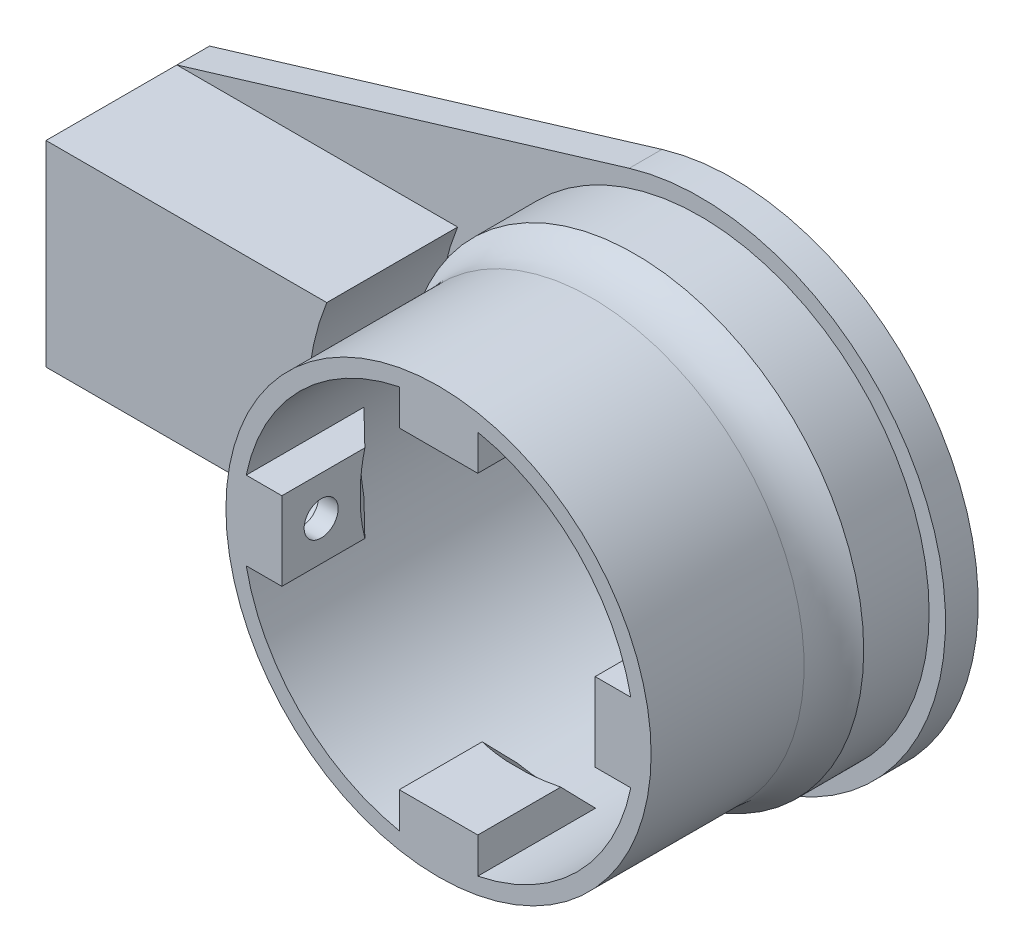
from build123d import *

# Parameters (mm, degrees)
ESQUISSE1_R                  = 30
BOSS_EXTRU_1_DEPTH           = 5
ESQUISSE6_R                  = 35
ESQUISSE6_R_2                = 30
BOSS_EXTRU_6_DEPTH           = 10
ESQUISSE7_R                  = 32.5
ESQUISSE7_R_2                = 30
BOSS_EXTRU_8_DEPTH           = 30
CONG_2_R                     = 10
BOSS_EXTRU_9_DEPTH           = 20
ESQUISSE9_W                  = 8
ESQUISSE9_H                  = 12
ESQUISSE9_W_2                = 12
ESQUISSE9_H_2                = 8
BOSS_EXTRU_10_DEPTH          = 12
CHANFREIN1_SIZE              = 6
ENL_V_MAT_EXTRU_1_REACH      = 86.89
ENL_V_MAT_EXTRU_1_END_RADIUS = 32.5
ESQUISSE10_R                 = 4.5
ESQUISSE12_R                 = 4.5
ESQUISSE12_R_2               = 2.6
BOSS_EXTRU_11_DEPTH          = 3


with BuildPart() as part:
    # Esquisse1 → Boss.-Extru.1 (new body)
    with BuildSketch(Plane.XY):
        with BuildLine():
            Line((-10.847469364, 35.896830061), (-80, 15))
            Line((-80, 15), (-80, -15))
            Line((-80, -15), (-10.847469364, -35.896830061))
            ThreePointArc((-10.847469364, -35.896830061), (37.5, 0), (-10.847469364, 35.896830061))
        make_face()
        Circle(ESQUISSE1_R, mode=Mode.SUBTRACT)
    extrude(amount=BOSS_EXTRU_1_DEPTH)

    # Esquisse6 → Boss.-Extru.6 (add)
    with BuildSketch(Plane.XY.offset(5)):
        Circle(ESQUISSE6_R)
        Circle(ESQUISSE6_R_2, mode=Mode.SUBTRACT)
    extrude(amount=BOSS_EXTRU_6_DEPTH)

    # Esquisse7 → Boss.-Extru.8 (add)
    with BuildSketch(Plane.XY.offset(15)):
        Circle(ESQUISSE7_R)
        Circle(ESQUISSE7_R_2, mode=Mode.SUBTRACT)
    extrude(amount=BOSS_EXTRU_8_DEPTH)

    # Congé2
    # the kernel refuses this fillet: 10 mm, written as the material it adds along each edge
    with BuildSketch(Plane(origin=(0, 0, 15), x_dir=(1, 0, 0), z_dir=(0, -1, 0))) as cong_2_piece_1:
        with BuildLine():
            CenterArc((42.5, 6.614378278), CONG_2_R, 180, 41.409622109)
            Line((32.5, 6.614378278), (32.3, 6.614378278))
            Line((32.3, 6.614378278), (32.3, 0))
            Line((32.3, 0), (32.5, -0.2))
            ThreePointArc((32.5, -0.2), (33.75, -0.2), (34.85, -0.132287566))
            Line((34.85, -0.132287566), (35, 0))
        make_face()
    revolve(axis=Axis((0, 0, 15), (0, 0, 1)))

    # Esquisse8 → Boss.-Extru.9 (add)
    with BuildSketch(Plane.XY.offset(5)):
        with BuildLine():
            Line((-80, 15), (-37.080992435, 15))
            ThreePointArc((-37.080992435, 15), (-40, 0), (-37.080992435, -15))
            Line((-37.080992435, -15), (-80, -15))
            Line((-80, -15), (-80, 15))
        make_face()
    extrude(amount=BOSS_EXTRU_9_DEPTH)

    # Esquisse9 → Boss.-Extru.10 (add)
    with BuildSketch(Plane.XY.offset(45)):
        with Locations((-27.941352507, 0)):
            Rectangle(ESQUISSE9_W, ESQUISSE9_H)
        with Locations((0, 27.941352507)):
            Rectangle(ESQUISSE9_W_2, ESQUISSE9_H_2)
        with Locations((27.941352507, 0)):
            Rectangle(ESQUISSE9_W, ESQUISSE9_H)
        with Locations((0, -27.941352507)):
            Rectangle(ESQUISSE9_W_2, ESQUISSE9_H_2)
    extrude(amount=-BOSS_EXTRU_10_DEPTH)

    # Chanfrein1
    # the kernel refuses this chamfer: 6 mm, written as the material it adds along each edge
    with BuildSketch(Plane(origin=(0, 0, 33), x_dir=(-0.6561519302770997, 0.75462881232672, 0), z_dir=(-0.75462881232672, -0.6561519302770997, 0))) as chanfrein1_piece_1_section:
        Polygon((30, CHANFREIN1_SIZE), (30 - CHANFREIN1_SIZE, 0), (30, 0), align=None)
    chanfrein1_piece_1 = revolve(axis=Axis((0, 0, 33), (0, 0, -1)), revolution_arc=82.01410645, mode=Mode.PRIVATE)
    chanfrein1_piece_1 = split(chanfrein1_piece_1, bisect_by=Plane(origin=(-6, 27.82841678, 31.008979001), z_dir=(1, 0, 0)), keep=Keep.TOP, mode=Mode.PRIVATE)
    chanfrein1_piece_1 = split(chanfrein1_piece_1, bisect_by=Plane(origin=(6, 27.82841678, 31.008979001), z_dir=(-1, 0, 0)), keep=Keep.TOP, mode=Mode.PRIVATE)
    chanfrein1_piece_1 = split(chanfrein1_piece_1, bisect_by=Plane(origin=(0, 23.941352507, 31.008979001), z_dir=(0, 1, 0)), keep=Keep.TOP, mode=Mode.PRIVATE)
    add(chanfrein1_piece_1)
    with BuildSketch(Plane(origin=(0, 0, 33), x_dir=(0.754635493716526, 0.6561442460490032, 0), z_dir=(-0.6561442460490032, 0.754635493716526, 0))) as chanfrein1_piece_2_section:
        Polygon((30, CHANFREIN1_SIZE), (30 - CHANFREIN1_SIZE, 0), (30, 0), align=None)
    chanfrein1_piece_2 = revolve(axis=Axis((0, 0, 33), (0, 0, -1)), revolution_arc=41.006469797, mode=Mode.PRIVATE)
    chanfrein1_piece_2 = split(chanfrein1_piece_2, bisect_by=Plane(origin=(27.828416771, 6, 31.008979004), z_dir=(0, -1, 0)), keep=Keep.TOP, mode=Mode.PRIVATE)
    chanfrein1_piece_2 = split(chanfrein1_piece_2, bisect_by=Plane(origin=(23.941352507, 3.002348554, 31.008979004), z_dir=(1, 0, 0)), keep=Keep.TOP, mode=Mode.PRIVATE)
    add(chanfrein1_piece_2)
    with BuildSketch(Plane(origin=(0, 0, 33), x_dir=(0.6561519302770998, -0.7546288123267199, 0), z_dir=(0.7546288123267199, 0.6561519302770998, 0))) as chanfrein1_piece_3_section:
        Polygon((30, CHANFREIN1_SIZE), (30 - CHANFREIN1_SIZE, 0), (30, 0), align=None)
    chanfrein1_piece_3 = revolve(axis=Axis((0, 0, 33), (0, 0, -1)), revolution_arc=82.01410645, mode=Mode.PRIVATE)
    chanfrein1_piece_3 = split(chanfrein1_piece_3, bisect_by=Plane(origin=(6, -27.82841678, 31.008979001), z_dir=(-1, 0, 0)), keep=Keep.TOP, mode=Mode.PRIVATE)
    chanfrein1_piece_3 = split(chanfrein1_piece_3, bisect_by=Plane(origin=(-6, -27.82841678, 31.008979001), z_dir=(1, 0, 0)), keep=Keep.TOP, mode=Mode.PRIVATE)
    chanfrein1_piece_3 = split(chanfrein1_piece_3, bisect_by=Plane(origin=(0, -23.941352507, 31.008979001), z_dir=(0, -1, 0)), keep=Keep.TOP, mode=Mode.PRIVATE)
    add(chanfrein1_piece_3)
    with BuildSketch(Plane(origin=(0, 0, 33), x_dir=(-0.7546288123267202, -0.6561519302770997, 0), z_dir=(0.6561519302770997, -0.7546288123267202, 0))) as chanfrein1_piece_4_section:
        Polygon((30, CHANFREIN1_SIZE), (30 - CHANFREIN1_SIZE, 0), (30, 0), align=None)
    chanfrein1_piece_4 = revolve(axis=Axis((0, 0, 33), (0, 0, -1)), revolution_arc=82.01410645, mode=Mode.PRIVATE)
    chanfrein1_piece_4 = split(chanfrein1_piece_4, bisect_by=Plane(origin=(-27.82841678, -6, 31.008979), z_dir=(0, 1, 0)), keep=Keep.TOP, mode=Mode.PRIVATE)
    chanfrein1_piece_4 = split(chanfrein1_piece_4, bisect_by=Plane(origin=(-27.82841678, 6, 31.008979), z_dir=(0, -1, 0)), keep=Keep.TOP, mode=Mode.PRIVATE)
    chanfrein1_piece_4 = split(chanfrein1_piece_4, bisect_by=Plane(origin=(-23.941352507, 0, 31.008979), z_dir=(-1, 0, 0)), keep=Keep.TOP, mode=Mode.PRIVATE)
    add(chanfrein1_piece_4)
    with BuildSketch(Plane(origin=(0, 0, 33), x_dir=(1, 0, 0), z_dir=(0, 1, 0))) as chanfrein1_piece_5_section:
        Polygon((30, CHANFREIN1_SIZE), (30 - CHANFREIN1_SIZE, 0), (30, 0), align=None)
    chanfrein1_piece_5 = revolve(axis=Axis((0, 0, 33), (0, 0, -1)), revolution_arc=41.006469797, mode=Mode.PRIVATE)
    chanfrein1_piece_5 = split(chanfrein1_piece_5, bisect_by=Plane(origin=(27.828416774, -6, 31.008979003), z_dir=(0, 1, 0)), keep=Keep.TOP, mode=Mode.PRIVATE)
    chanfrein1_piece_5 = split(chanfrein1_piece_5, bisect_by=Plane(origin=(23.941352507, -3.002348554, 31.008979003), z_dir=(1, 0, 0)), keep=Keep.TOP, mode=Mode.PRIVATE)
    add(chanfrein1_piece_5)

    # Enlèv. mat.-Extru.1: up to this cylinder (the profile starts inside it)
    enl_v_mat_extru_1_end = Plane(origin=(0, 0, 39), z_dir=(0, 0, -1)) * Cylinder(ENL_V_MAT_EXTRU_1_END_RADIUS, 239.78, mode=Mode.PRIVATE)
    # Esquisse10 → Enlèv. mat.-Extru.1 (cut, up to the surface)
    with BuildSketch(Plane(origin=(-23.941352507, 0, 0), x_dir=(0, 0, -1), z_dir=(1, 0, 0)), mode=Mode.PRIVATE) as enl_v_mat_extru_1_sk1:
        with Locations((-39, 0)):
            Circle(ESQUISSE10_R)
    enl_v_mat_extru_1_tool1 = extrude(enl_v_mat_extru_1_sk1.sketch, amount=-ENL_V_MAT_EXTRU_1_REACH, mode=Mode.PRIVATE) & enl_v_mat_extru_1_end
    add(enl_v_mat_extru_1_tool1.solids().sort_by_distance((-23.941353, 0, 39))[0], mode=Mode.SUBTRACT)

    # Esquisse12 → Boss.-Extru.11 (add)
    with BuildSketch(Plane(origin=(-23.941352507, 0, 0), x_dir=(0, 0, -1), z_dir=(1, 0, 0))):
        with Locations((-39, 0)):
            Circle(ESQUISSE12_R)
        with Locations((-39, 0)):
            Circle(ESQUISSE12_R_2, mode=Mode.SUBTRACT)
    extrude(amount=-BOSS_EXTRU_11_DEPTH)


solid = part.part
